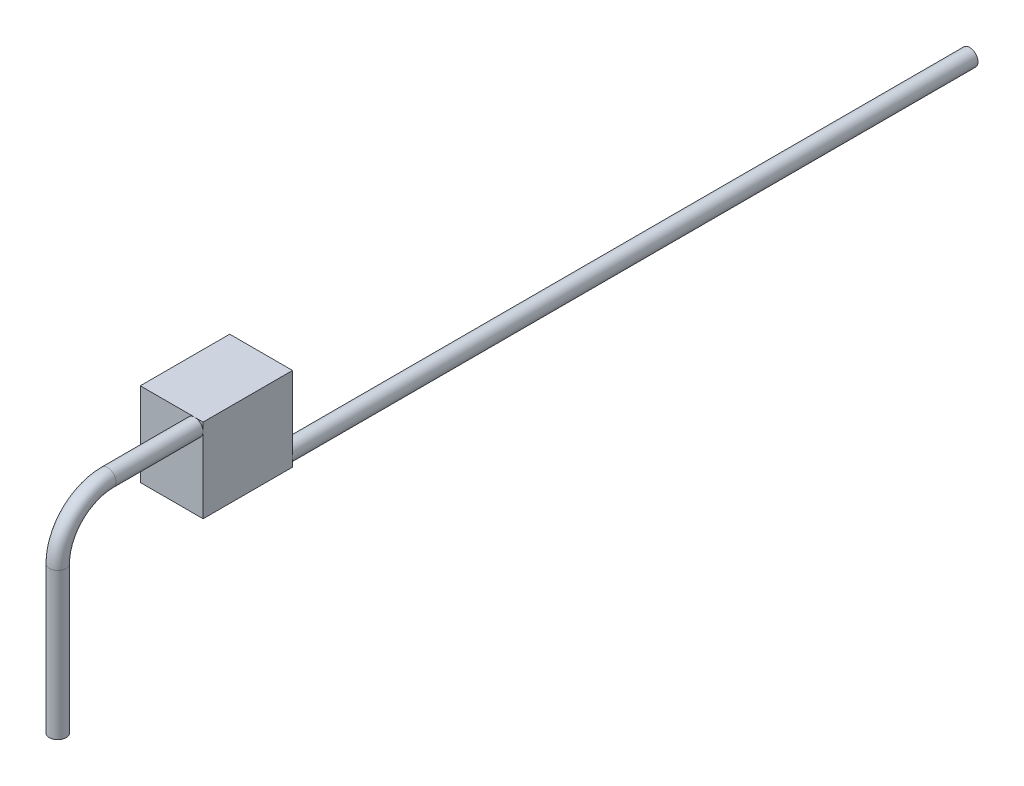
from build123d import *

# Parameters (mm, degrees)
SKETCH1_R                = 1.984375
BOSS_EXTRUDE1_DEPTH      = 170
BOSS_EXTRUDE2_DEPTH      = 15
BOSS_EXTRUDE2_DEPTH_BACK = 6.35
SKETCH2_W                = 15
SKETCH2_H                = 20
SKETCH3_R                = 1.984375
BOSS_EXTRUDE3_DEPTH      = 20.799999976
SKETCH4_R                = 1.984375
REVOLVE5_ANGLE           = 90
SKETCH6_R                = 1.984375
BOSS_EXTRUDE4_DEPTH      = 35.000000038


with BuildPart() as part:
    # Sketch1 → Boss-Extrude1 (new body)
    with BuildSketch(Plane.XY):
        Circle(SKETCH1_R)
    extrude(amount=BOSS_EXTRUDE1_DEPTH)

    # Sketch2 → Boss-Extrude2 (add, two sides: drawn at the far end of the back side and taken through both)
    with BuildSketch(Plane.XY.offset(170).offset(-BOSS_EXTRUDE2_DEPTH_BACK)):
        with Locations((-5.515625, 8.015625)):
            Rectangle(SKETCH2_W, SKETCH2_H)
    extrude(amount=BOSS_EXTRUDE2_DEPTH + BOSS_EXTRUDE2_DEPTH_BACK)

    # Sketch3 → Boss-Extrude3 (add)
    with BuildSketch(Plane.XY.offset(185)):
        with Locations((0, 16.03125)):
            Circle(SKETCH3_R)
    extrude(amount=BOSS_EXTRUDE3_DEPTH)

    # Sketch4 → Revolve5 (revolve)
    with BuildSketch(Plane.XY.offset(205.799999976)):
        with Locations((0, 16.03125)):
            Circle(SKETCH4_R)
    revolve(axis=Axis((-5.972283048, 4.112992181, 205.799999976), (1, 0, 0)), revolution_arc=REVOLVE5_ANGLE)

    # Sketch6 → Boss-Extrude4 (add)
    with BuildSketch(Plane.XZ.offset(-4.112992181)):
        with Locations((0, 217.718257795)):
            Circle(SKETCH6_R)
    extrude(amount=BOSS_EXTRUDE4_DEPTH)


solid = part.part
